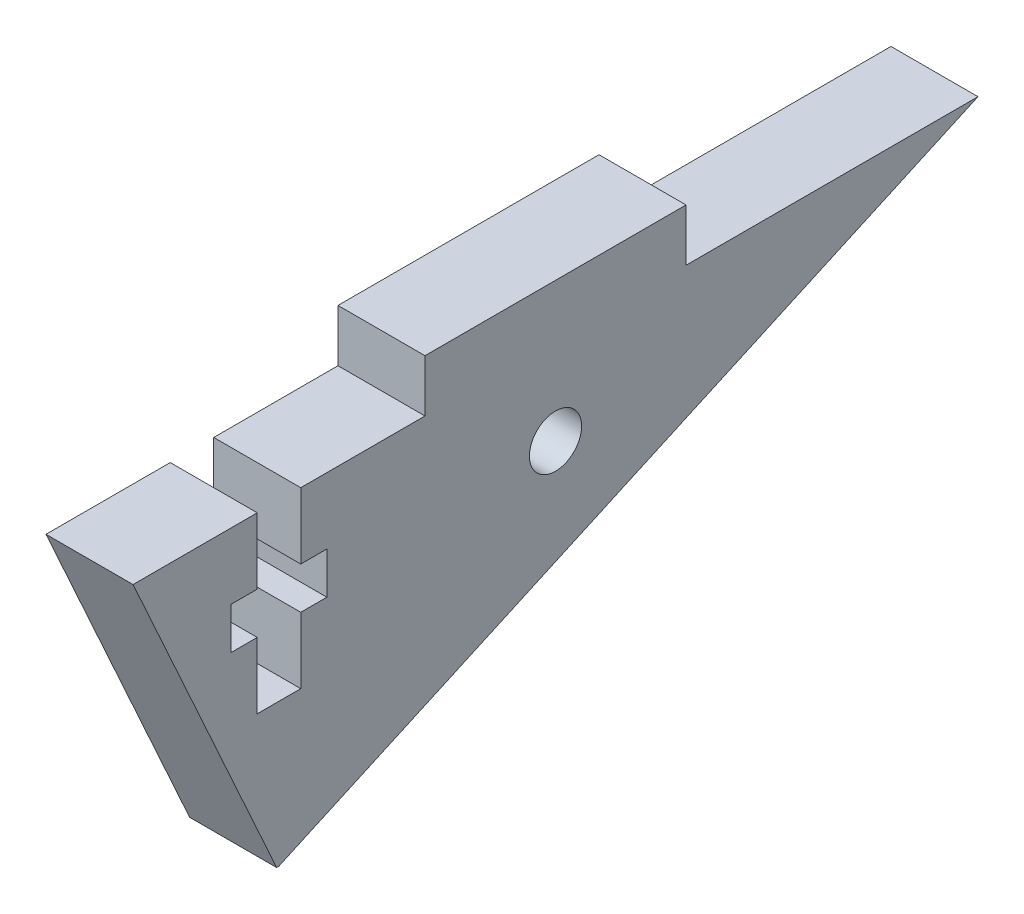
from build123d import *

# Parameters (mm, degrees)
SCHIZZO1_W                   = 48.55
SCHIZZO1_H                   = 18.21
ESTRUSIONE_ESTRUSIONE1_DEPTH = 5
TAGLIO_ESTRUSIONE1_DEPTH     = 27.404102901
SCHIZZO3_R                   = 1.5
TAGLIO_ESTRUSIONE2_DEPTH     = 27.404102901
SCHIZZO4_W                   = 5
SCHIZZO4_H                   = 15
ESTRUSIONE_ESTRUSIONE2_DEPTH = 3
TAGLIO_ESTRUSIONE3_DEPTH     = 28.58272376


with BuildPart() as part:
    # Schizzo1 → Estrusione-Estrusione1 (new body)
    with BuildSketch(Plane(origin=(0, 0, 0), x_dir=(0, 0, -1), z_dir=(1, 0, 0))):
        Rectangle(SCHIZZO1_W, SCHIZZO1_H)
    extrude(amount=ESTRUSIONE_ESTRUSIONE1_DEPTH)

    # Schizzo2 → Taglio-Estrusione1 (cut, through all)
    with BuildSketch(Plane(origin=(0, 0, 0), x_dir=(0, 0, -1), z_dir=(1, 0, 0))):
        Polygon((24.275, 9.105), (-15.905998409, -9.105), (24.275, -9.105), align=None)
        Polygon((-24.275, 9.105), (-24.275, -9.105), (-16.019269678, -9.111556119), align=None)
    extrude(amount=TAGLIO_ESTRUSIONE1_DEPTH, mode=Mode.SUBTRACT)

    # Schizzo3 → Taglio-Estrusione2 (cut, through all)
    with BuildSketch(Plane(origin=(0, 0, 0), x_dir=(0, 0, -1), z_dir=(1, 0, 0))):
        with Locations((0, 4.105)):
            Circle(SCHIZZO3_R)
    extrude(amount=TAGLIO_ESTRUSIONE2_DEPTH, mode=Mode.SUBTRACT)

    # Schizzo4 → Estrusione-Estrusione2 (add)
    with BuildSketch(Plane(origin=(0, 9.105, 0), x_dir=(1, 0, 0), z_dir=(0, 1, 0))):
        with Locations((2.5, 0)):
            Rectangle(SCHIZZO4_W, SCHIZZO4_H)
    extrude(amount=ESTRUSIONE_ESTRUSIONE2_DEPTH)

    # Schizzo6 → Taglio-Estrusione3 (cut, through all)
    with BuildSketch(Plane(origin=(0, 0, 0), x_dir=(0, 0, -1), z_dir=(1, 0, 0))):
        Polygon((-17.1375, -0.895), (-17.1375, 2.905), (-18.6375, 2.905), (-18.6375, 5.305), (-17.1375, 5.305), (-17.1375, 9.105), (-14.6375, 9.105), (-14.6375, 5.305), (-13.1375, 5.305), (-13.1375, 2.905), (-14.6375, 2.905), (-14.6375, -0.895), align=None)
    extrude(amount=TAGLIO_ESTRUSIONE3_DEPTH, mode=Mode.SUBTRACT)


solid = part.part
